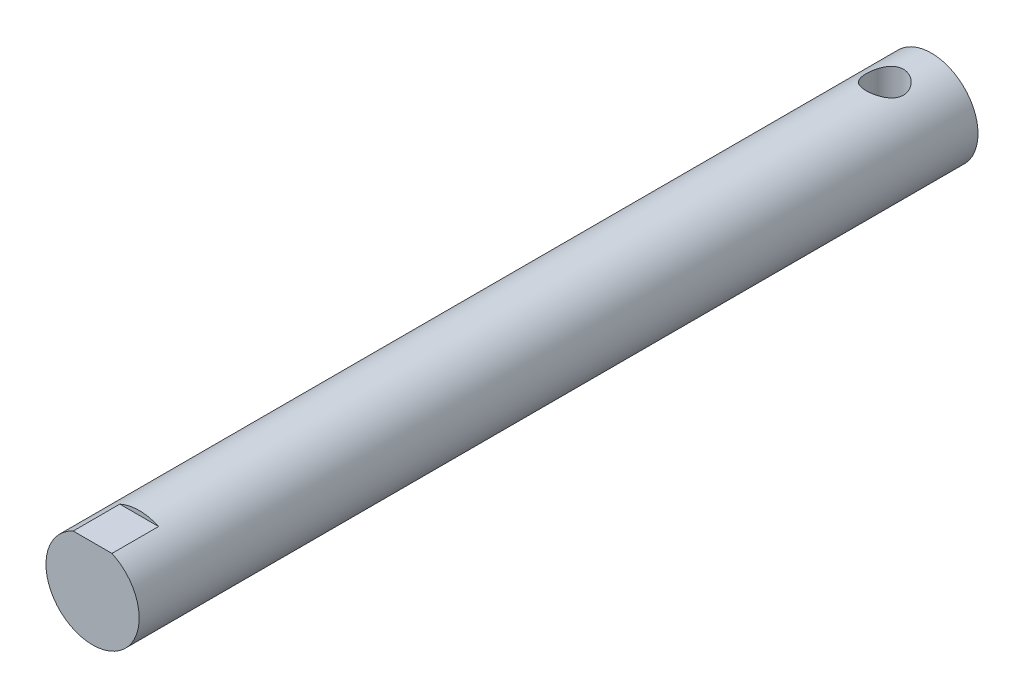
from build123d import *

# Parameters (mm, degrees)
SKETCH1_R               = 10
BOSS_EXTRUDE1_DEPTH     = 180
CUT_EXTRUDE1_DEPTH      = 181.554700853
CUT_EXTRUDE1_DEPTH_BACK = 181.554700853
SKETCH2_R               = 4
CUT_EXTRUDE2_START      = -10
CUT_EXTRUDE2_DEPTH      = 10


with BuildPart() as part:
    # Sketch1 → Boss-Extrude1 (new body)
    with BuildSketch(Plane.XY):
        Circle(SKETCH1_R)
    extrude(amount=BOSS_EXTRUDE1_DEPTH)

    # Sketch2 → Cut-Extrude1 (cut, two sides: drawn at the far end of the back side and taken through both)
    with BuildSketch(Plane(origin=(0, 0, 0), x_dir=(1, 0, 0), z_dir=(0, 1, 0)).offset(-CUT_EXTRUDE1_DEPTH_BACK)):
        with Locations((0, -10)):
            Circle(SKETCH2_R)
    extrude(amount=CUT_EXTRUDE1_DEPTH + CUT_EXTRUDE1_DEPTH_BACK, mode=Mode.SUBTRACT)

    # Sketch3 → Cut-Extrude2 (cut)
    with BuildSketch(Plane.XY.offset(180).offset(CUT_EXTRUDE2_START)):
        with BuildLine():
            Line((-4.161531139, 9.092945539), (4.161531139, 9.092945539))
            ThreePointArc((4.161531139, 9.092945539), (0, 10), (-4.161531139, 9.092945539))
        make_face()
    extrude(amount=CUT_EXTRUDE2_DEPTH, mode=Mode.SUBTRACT)


solid = part.part
